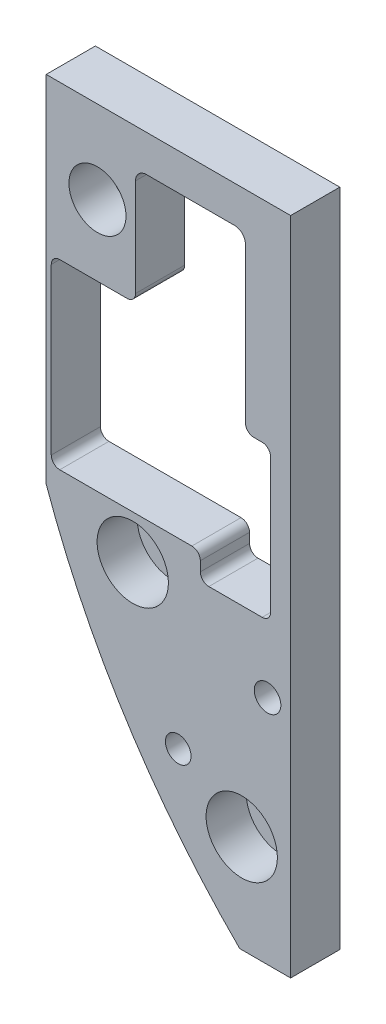
from build123d import *

# Parameters (mm, degrees)
SKETCH1_R           = 2.15265
SKETCH1_R_2         = 2.487009827
SKETCH1_R_3         = 2.39450721
BOSS_EXTRUDE1_DEPTH = 10.8
SKETCH3_R           = 6.6675
SKETCH3_R_2         = 5.334
CUT_EXTRUDE1_DEPTH  = 7.5
CUT_EXTRUDE2_DEPTH  = 1.6


with BuildPart() as part:
    # Sketch1 → Boss-Extrude1 (new body)
    with BuildSketch(Plane.XY):
        with BuildLine():
            Line((0, -17.78), (-45.72, -17.78))
            Line((-45.72, -17.78), (-45.72, -84.1375))
            ThreePointArc((-45.72, -84.1375), (-30.833523511, -114.746148224), (-9.525, -141.2875))
            Line((-9.525, -141.2875), (0, -141.2875))
            Line((0, -141.2875), (0, -17.78))
        make_face()
        with Locations((-36.1315, -33.274)):
            Circle(SKETCH1_R, mode=Mode.SUBTRACT)
        with Locations((-29.5275, -88.7095)):
            Circle(SKETCH1_R, mode=Mode.SUBTRACT)
        with Locations((-9.144, -122.9995)):
            Circle(SKETCH1_R, mode=Mode.SUBTRACT)
        with Locations((-4.3173518, -98.035919174)):
            Circle(SKETCH1_R_2, mode=Mode.SUBTRACT)
        with Locations((-21.024674116, -114.680376144)):
            Circle(SKETCH1_R_3, mode=Mode.SUBTRACT)
        with BuildLine():
            Line((-30.5943, -46.501483685), (-43.185677441, -46.501483685))
            ThreePointArc((-43.185677441, -46.501483685), (-44.308209457, -46.96645167), (-44.773177441, -48.088983685))
            Line((-44.773177441, -48.088983685), (-44.773177441, -78.965225138))
            ThreePointArc((-44.773177441, -78.965225138), (-44.308209457, -80.087757153), (-43.185677441, -80.552725138))
            Line((-43.185677441, -80.552725138), (-18.474223541, -80.552725138))
            ThreePointArc((-18.474223541, -80.552725138), (-17.351691526, -81.017693123), (-16.886723541, -82.140225138))
            Line((-16.886723541, -82.140225138), (-16.886723541, -83.937143103))
            ThreePointArc((-16.886723541, -83.937143103), (-16.421755557, -85.059675118), (-15.299223541, -85.524643103))
            Line((-15.299223541, -85.524643103), (-5.327492268, -85.524643103))
            ThreePointArc((-5.327492268, -85.524643103), (-4.204960252, -85.059675118), (-3.739992268, -83.937143103))
            Line((-3.739992268, -83.937143103), (-3.739992268, -58.7502))
            ThreePointArc((-3.739992268, -58.7502), (-4.204960252, -57.627667985), (-5.327492268, -57.1627))
            Line((-5.327492268, -57.1627), (-6.8707, -57.1627))
            ThreePointArc((-6.8707, -57.1627), (-7.993232015, -56.697732015), (-8.4582, -55.5752))
            Line((-8.4582, -55.5752), (-8.4582, -26.6573))
            ThreePointArc((-8.4582, -26.6573), (-9.053359021, -25.220459021), (-10.4902, -24.6253))
            Line((-10.4902, -24.6253), (-26.9748, -24.6253))
            ThreePointArc((-26.9748, -24.6253), (-28.411640979, -25.220459021), (-29.0068, -26.6573))
            Line((-29.0068, -26.6573), (-29.0068, -44.913983685))
            ThreePointArc((-29.0068, -44.913983685), (-29.471767985, -46.036515701), (-30.5943, -46.501483685))
        make_face(mode=Mode.SUBTRACT)
    extrude(amount=BOSS_EXTRUDE1_DEPTH)

    # Sketch3 → Cut-Extrude1 (cut)
    with BuildSketch(Plane.XY.offset(10.8)):
        with Locations((-9.144, -122.9995)):
            Circle(SKETCH3_R)
        with Locations((-29.5275, -88.7095)):
            Circle(SKETCH3_R)
        with Locations((-36.1315, -33.274)):
            Circle(SKETCH3_R_2)
    extrude(amount=-CUT_EXTRUDE1_DEPTH, mode=Mode.SUBTRACT)

    # Sketch4 → Cut-Extrude2 (cut)
    with BuildSketch(Plane(origin=(0, 0, 0), x_dir=(-1, 0, 0), z_dir=(0, 0, -1))):
        with BuildLine():
            Line((0, -17.78), (0, -141.2875))
            Line((0, -141.2875), (9.525, -141.2875))
            ThreePointArc((9.525, -141.2875), (30.833523511, -114.746148224), (45.72, -84.1375))
            Line((45.72, -84.1375), (45.72, -17.78))
            Line((45.72, -17.78), (0, -17.78))
        make_face()
    extrude(amount=-CUT_EXTRUDE2_DEPTH, mode=Mode.SUBTRACT)


solid = part.part
